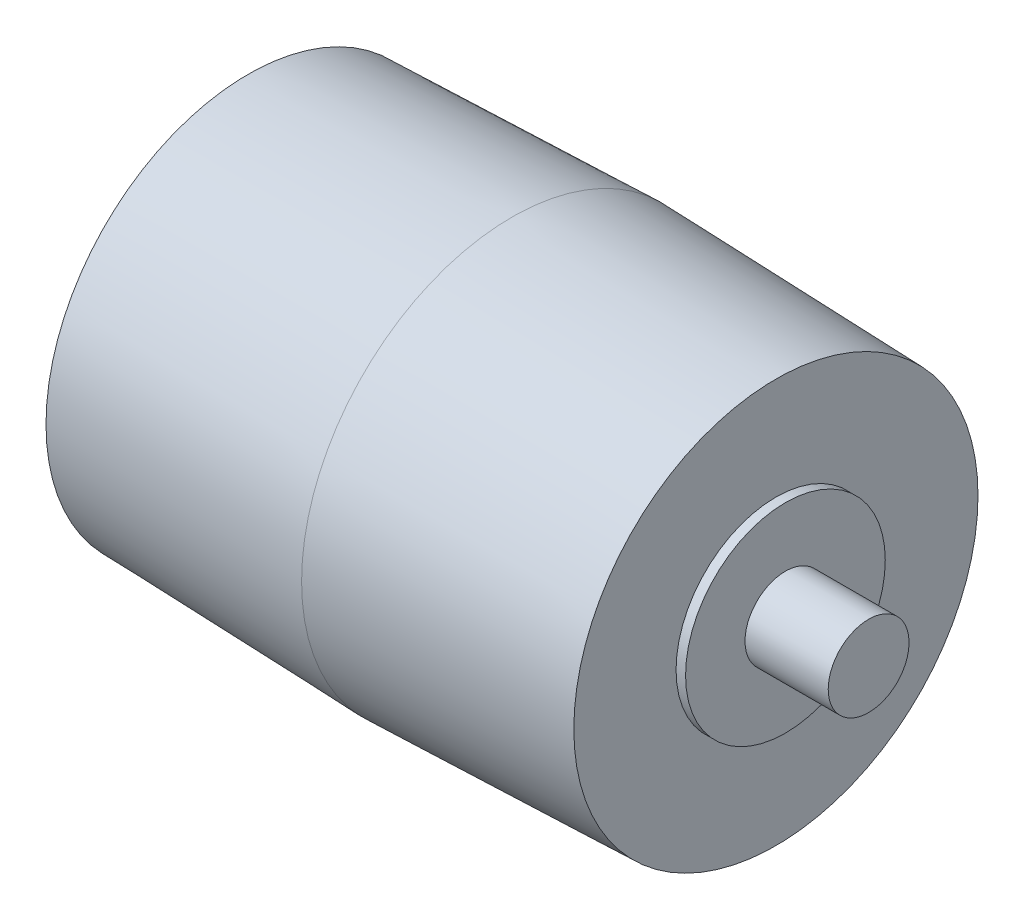
from build123d import *


with BuildPart() as part:
    # Sketch1 → Revolve1 (revolve)
    with BuildSketch(Plane.XY):
        Polygon((-9.525, 0), (-9.525, 1.0795), (-7.3025, 1.0795), (-7.3025, 2.667), (-7.0485, 2.667), (-7.0485, 5.3975), (0, 5.61975), (7.0485, 5.3975), (7.0485, 2.667), (7.3025, 2.667), (7.3025, 1.0795), (9.525, 1.0795), (9.525, 0), align=None)
    revolve(axis=Axis((-9.525, 0, 0), (1, 0, 0)))


solid = part.part
